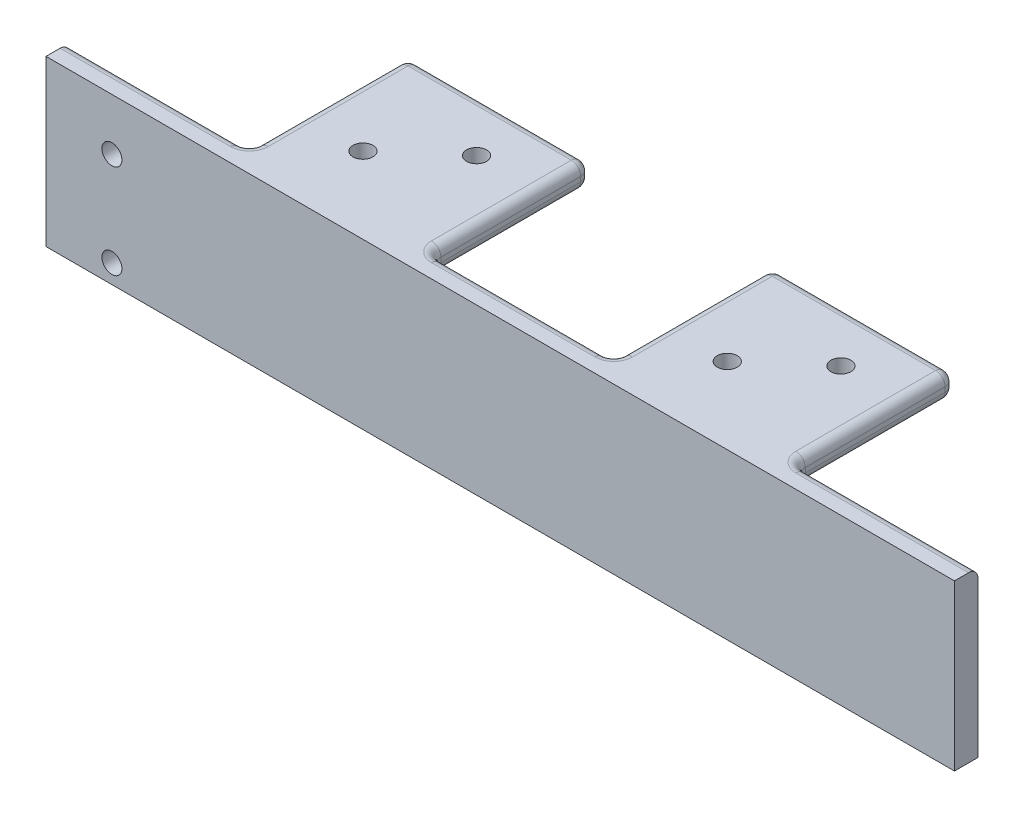
from build123d import *

# Parameters (mm, degrees)
SKETCH1_W           = 193
SKETCH1_H           = 5
BOSS_EXTRUDE1_DEPTH = 15
BOSS_EXTRUDE2_DEPTH = 5
CUT_EXTRUDE1_REACH  = 109.344
SKETCH3_R           = 2.125
FILLET3_R           = 2
FILLET4_R           = 2
SKETCH4_R           = 2.125
CUT_EXTRUDE2_DEPTH  = 106.877004204


with BuildPart() as part:
    # Sketch1 → Boss-Extrude1 (new, symmetric)
    with BuildSketch(Plane(origin=(0, 0, 0), x_dir=(1, 0, 0), z_dir=(0, 1, 0))):
        Rectangle(SKETCH1_W, SKETCH1_H)
    extrude(amount=BOSS_EXTRUDE1_DEPTH, both=True)

    # Sketch2 → Boss-Extrude2 (add)
    with BuildSketch(Plane(origin=(0, 15, 0), x_dir=(1, 0, 0), z_dir=(0, 1, 0))):
        Polygon((-58.3, 36.2), (-58.3, 2.5), (-96.5, 2.5), (-96.5, -2.5), (96.5, -2.5), (96.5, 2.5), (57.8, 2.5), (57.8, 36.2), (19.1, 36.2), (19.1, 2.5), (-19.6, 2.5), (-19.6, 36.2), align=None)
    extrude(amount=BOSS_EXTRUDE2_DEPTH)

    # Sketch3 → Cut-Extrude1 (cut, up to next)
    with BuildSketch(Plane.XZ.offset(-15), mode=Mode.PRIVATE) as cut_extrude1_sk1:
        with Locations(Location((-45.4, -13.73, 0), (0, 0, 270))):
            Circle(SKETCH3_R)
    cut_extrude1_tool1 = extrude(cut_extrude1_sk1.sketch, amount=-CUT_EXTRUDE1_REACH, mode=Mode.PRIVATE) & part.part
    # Sketch3 → Cut-Extrude1 (cut, up to next)
    with BuildSketch(Plane.XZ.offset(-15), mode=Mode.PRIVATE) as cut_extrude1_sk2:
        with Locations(Location((-32.5, -24.97, 0), (0, 0, 270))):
            Circle(SKETCH3_R)
    cut_extrude1_tool2 = extrude(cut_extrude1_sk2.sketch, amount=-CUT_EXTRUDE1_REACH, mode=Mode.PRIVATE) & part.part
    # Sketch3 → Cut-Extrude1 (cut, up to next)
    with BuildSketch(Plane.XZ.offset(-15), mode=Mode.PRIVATE) as cut_extrude1_sk3:
        with Locations(Location((32, -13.73, 0), (0, 0, 270))):
            Circle(SKETCH3_R)
    cut_extrude1_tool3 = extrude(cut_extrude1_sk3.sketch, amount=-CUT_EXTRUDE1_REACH, mode=Mode.PRIVATE) & part.part
    # Sketch3 → Cut-Extrude1 (cut, up to next)
    with BuildSketch(Plane.XZ.offset(-15), mode=Mode.PRIVATE) as cut_extrude1_sk4:
        with Locations(Location((44.9, -24.97, 0), (0, 0, 270))):
            Circle(SKETCH3_R)
    cut_extrude1_tool4 = extrude(cut_extrude1_sk4.sketch, amount=-CUT_EXTRUDE1_REACH, mode=Mode.PRIVATE) & part.part
    add(cut_extrude1_tool1.solids().sort_by_distance((-45.4, 15, -13.73))[0], mode=Mode.SUBTRACT)
    add(cut_extrude1_tool2.solids().sort_by_distance((-32.5, 15, -24.97))[0], mode=Mode.SUBTRACT)
    add(cut_extrude1_tool3.solids().sort_by_distance((32, 15, -13.73))[0], mode=Mode.SUBTRACT)
    add(cut_extrude1_tool4.solids().sort_by_distance((44.9, 15, -24.97))[0], mode=Mode.SUBTRACT)

    # Fillet3
    fillet3_edges = [part.edges().sort_by_distance(p)[0] for p in [
        (-58.3, 17.5, -36.2),
        (-58.3, 17.5, -2.5),
        (57.8, 17.5, -2.5),
        (57.8, 17.5, -36.2),
        (19.1, 17.5, -36.2),
        (19.1, 17.5, -2.5),
        (-19.6, 17.5, -2.5),
        (-19.6, 17.5, -36.2),
    ]]
    fillet(fillet3_edges, radius=FILLET3_R)

    # Fillet4
    # the kernel refuses this fillet: 2 mm, written as the material it takes off along each edge
    with BuildSketch(Plane(origin=(21.1, 20, -34.2), x_dir=(-1, 0, 0), z_dir=(0, 0, 1))) as fillet4_piece_1:
        with BuildLine():
            CenterArc((2 - FILLET4_R, FILLET4_R), FILLET4_R, 270, 90)
            Line((2 - FILLET4_R, 0), (2, 0))
            Line((2, 0), (2, FILLET4_R))
        make_face()
    revolve(axis=Axis((21.1, 20, -34.2), (0, -1, 0)), revolution_arc=90, mode=Mode.SUBTRACT)
    with BuildSketch(Plane(origin=(-21.6, 20, -34.2), x_dir=(1, 0, 0), z_dir=(0, 0, 1))) as fillet4_piece_2:
        with BuildLine():
            CenterArc((2 - FILLET4_R, -FILLET4_R), FILLET4_R, 0, 90)
            Line((2 - FILLET4_R, 0), (2, 0))
            Line((2, 0), (2, -FILLET4_R))
        make_face()
    revolve(axis=Axis((-21.6, 20, -34.2), (0, 1, 0)), revolution_arc=90, mode=Mode.SUBTRACT)
    with BuildSketch(Plane(origin=(-56.3, 20, -34.2), x_dir=(-1, 0, 0), z_dir=(0, 0, 1))) as fillet4_piece_3:
        with BuildLine():
            CenterArc((2 - FILLET4_R, FILLET4_R), FILLET4_R, 270, 90)
            Line((2 - FILLET4_R, 0), (2, 0))
            Line((2, 0), (2, FILLET4_R))
        make_face()
    revolve(axis=Axis((-56.3, 20, -34.2), (0, -1, 0)), revolution_arc=90, mode=Mode.SUBTRACT)
    with BuildSketch(Plane(origin=(19.1, 15, -34.2), x_dir=(0, 1, 0), z_dir=(0, 0, 1)), Plane(origin=(57.8, 15, -4.5), x_dir=(0, 1, 0), z_dir=(0, 0, -1)), Plane(origin=(-19.6, 15, -4.5), x_dir=(0, 1, 0), z_dir=(0, 0, -1)), Plane(origin=(-58.3, 15, -34.2), x_dir=(0, 1, 0), z_dir=(0, 0, 1))) as fillet4_piece_4:
        with BuildLine():
            CenterArc((FILLET4_R, -FILLET4_R), FILLET4_R, 90, 90)
            Line((0, -FILLET4_R), (0, 0))
            Line((0, 0), (FILLET4_R, 0))
        make_face()
    extrude(amount=29.7, mode=Mode.SUBTRACT)
    with BuildSketch(Plane(origin=(55.8, 15, -36.2), x_dir=(0, 1, 0), z_dir=(-1, 0, 0)), Plane(origin=(-21.6, 15, -36.2), x_dir=(0, 1, 0), z_dir=(-1, 0, 0))) as fillet4_piece_5:
        with BuildLine():
            CenterArc((FILLET4_R, -FILLET4_R), FILLET4_R, 90, 90)
            Line((0, -FILLET4_R), (0, 0))
            Line((0, 0), (FILLET4_R, 0))
        make_face()
    extrude(amount=34.7, mode=Mode.SUBTRACT)
    with BuildSketch(Plane(origin=(55.8, 15, -34.2), x_dir=(1, 0, 0), z_dir=(0, 0, 1))) as fillet4_piece_6:
        with BuildLine():
            CenterArc((2 - FILLET4_R, FILLET4_R), FILLET4_R, 270, 90)
            Line((2 - FILLET4_R, 0), (2, 0))
            Line((2, 0), (2, FILLET4_R))
        make_face()
    revolve(axis=Axis((55.8, 15, -34.2), (0, 1, 0)), revolution_arc=90, mode=Mode.SUBTRACT)
    with BuildSketch(Plane(origin=(21.1, 15, -34.2), x_dir=(-1, 0, 0), z_dir=(0, 0, 1))) as fillet4_piece_7:
        with BuildLine():
            CenterArc((2 - FILLET4_R, -FILLET4_R), FILLET4_R, 0, 90)
            Line((2 - FILLET4_R, 0), (2, 0))
            Line((2, 0), (2, -FILLET4_R))
        make_face()
    revolve(axis=Axis((21.1, 15, -34.2), (0, -1, 0)), revolution_arc=90, mode=Mode.SUBTRACT)
    with BuildSketch(Plane(origin=(-17.6, 15, -4.5), x_dir=(0.5976672776328267, 0, -0.8017442392976488), z_dir=(-0.8017442392976488, 0, -0.5976672776328267))) as fillet4_piece_8_section:
        with BuildLine():
            CenterArc((2 + FILLET4_R, -FILLET4_R), FILLET4_R, 90, 90)
            Line((2, -FILLET4_R), (2, 0))
            Line((2, 0), (2 + FILLET4_R, 0))
        make_face()
    fillet4_piece_8 = revolve(axis=Axis((-17.6, 15, -4.5), (0, -1, 0)), revolution_arc=233.296989237, mode=Mode.PRIVATE)
    fillet4_piece_8 = split(fillet4_piece_8, bisect_by=Plane(origin=(-19.099877837, 15.623256941, -2.5), z_dir=(0, 0, -1)), keep=Keep.TOP, mode=Mode.PRIVATE)
    add(fillet4_piece_8, mode=Mode.SUBTRACT)
    with BuildSketch(Plane(origin=(-17.6, 20, -4.5), x_dir=(0, 0, 1), z_dir=(1, 0, 0))) as fillet4_piece_9:
        with BuildLine():
            CenterArc((2 + FILLET4_R, FILLET4_R), FILLET4_R, 180, 90)
            Line((2 + FILLET4_R, 0), (2, 0))
            Line((2, 0), (2, FILLET4_R))
        make_face()
    revolve(axis=Axis((-17.6, 20, -4.5), (0, -1, 0)), revolution_arc=90, mode=Mode.SUBTRACT)
    with BuildSketch(Plane(origin=(-60.3, 15, -4.5), x_dir=(-0.5976672776328267, 0, -0.8017442392976488), z_dir=(0.8017442392976488, 0, -0.5976672776328267))) as fillet4_piece_10_section:
        with BuildLine():
            CenterArc((2 + FILLET4_R, FILLET4_R), FILLET4_R, 180, 90)
            Line((2 + FILLET4_R, 0), (2, 0))
            Line((2, 0), (2, FILLET4_R))
        make_face()
    fillet4_piece_10 = revolve(axis=Axis((-60.3, 15, -4.5), (0, 1, 0)), revolution_arc=233.296989237, mode=Mode.PRIVATE)
    fillet4_piece_10 = split(fillet4_piece_10, bisect_by=Plane(origin=(-58.800122111, 15.623256622, -2.5), z_dir=(0, 0, -1)), keep=Keep.TOP, mode=Mode.PRIVATE)
    add(fillet4_piece_10, mode=Mode.SUBTRACT)
    with BuildSketch(Plane(origin=(-60.3, 20, -4.5), x_dir=(0, 0, 1), z_dir=(-1, 0, 0))) as fillet4_piece_11:
        with BuildLine():
            CenterArc((2 + FILLET4_R, -FILLET4_R), FILLET4_R, 90, 90)
            Line((2 + FILLET4_R, 0), (2, 0))
            Line((2, 0), (2, -FILLET4_R))
        make_face()
    revolve(axis=Axis((-60.3, 20, -4.5), (0, 1, 0)), revolution_arc=90, mode=Mode.SUBTRACT)
    with BuildSketch(Plane(origin=(17.1, 15, -4.5), x_dir=(-0.5976672776328281, 0, -0.8017442392976479), z_dir=(0.8017442392976479, 0, -0.5976672776328281))) as fillet4_piece_12_section:
        with BuildLine():
            CenterArc((2 + FILLET4_R, FILLET4_R), FILLET4_R, 180, 90)
            Line((2 + FILLET4_R, 0), (2, 0))
            Line((2, 0), (2, FILLET4_R))
        make_face()
    fillet4_piece_12 = revolve(axis=Axis((17.1, 15, -4.5), (0, 1, 0)), revolution_arc=233.296989237, mode=Mode.PRIVATE)
    fillet4_piece_12 = split(fillet4_piece_12, bisect_by=Plane(origin=(18.599877909, 15.623256541, -2.5), z_dir=(0, 0, -1)), keep=Keep.TOP, mode=Mode.PRIVATE)
    add(fillet4_piece_12, mode=Mode.SUBTRACT)
    with BuildSketch(Plane(origin=(17.1, 20, -4.5), x_dir=(0, 0, 1), z_dir=(-1, 0, 0))) as fillet4_piece_13:
        with BuildLine():
            CenterArc((2 + FILLET4_R, -FILLET4_R), FILLET4_R, 90, 90)
            Line((2 + FILLET4_R, 0), (2, 0))
            Line((2, 0), (2, -FILLET4_R))
        make_face()
    revolve(axis=Axis((17.1, 20, -4.5), (0, 1, 0)), revolution_arc=90, mode=Mode.SUBTRACT)
    with BuildSketch(Plane(origin=(59.8, 15, -4.5), x_dir=(0.5976672776328267, 0, -0.8017442392976488), z_dir=(-0.8017442392976488, 0, -0.5976672776328267))) as fillet4_piece_14_section:
        with BuildLine():
            CenterArc((2 + FILLET4_R, -FILLET4_R), FILLET4_R, 90, 90)
            Line((2, -FILLET4_R), (2, 0))
            Line((2, 0), (2 + FILLET4_R, 0))
        make_face()
    fillet4_piece_14 = revolve(axis=Axis((59.8, 15, -4.5), (0, -1, 0)), revolution_arc=233.296989237, mode=Mode.PRIVATE)
    fillet4_piece_14 = split(fillet4_piece_14, bisect_by=Plane(origin=(58.300122152, 15.623256947, -2.5), z_dir=(0, 0, -1)), keep=Keep.TOP, mode=Mode.PRIVATE)
    add(fillet4_piece_14, mode=Mode.SUBTRACT)
    with BuildSketch(Plane(origin=(59.8, 20, -4.5), x_dir=(0, 0, 1), z_dir=(1, 0, 0))) as fillet4_piece_15:
        with BuildLine():
            CenterArc((2 + FILLET4_R, FILLET4_R), FILLET4_R, 180, 90)
            Line((2 + FILLET4_R, 0), (2, 0))
            Line((2, 0), (2, FILLET4_R))
        make_face()
    revolve(axis=Axis((59.8, 20, -4.5), (0, -1, 0)), revolution_arc=90, mode=Mode.SUBTRACT)
    with BuildSketch(Plane(origin=(101.5, 20, -2.5), x_dir=(0, -1, 0), z_dir=(-1, 0, 0))) as fillet4_piece_16:
        with BuildLine():
            CenterArc((FILLET4_R, FILLET4_R), FILLET4_R, 180, 90)
            Line((0, FILLET4_R), (0, 0))
            Line((0, 0), (FILLET4_R, 0))
        make_face()
    extrude(amount=41.7, mode=Mode.SUBTRACT)
    with BuildSketch(Plane(origin=(-19.6, 20, -4.5), x_dir=(0, -1, 0), z_dir=(0, 0, -1)), Plane(origin=(-58.3, 20, -34.2), x_dir=(0, -1, 0), z_dir=(0, 0, 1)), Plane(origin=(57.8, 20, -4.5), x_dir=(0, -1, 0), z_dir=(0, 0, -1)), Plane(origin=(19.1, 20, -34.2), x_dir=(0, -1, 0), z_dir=(0, 0, 1))) as fillet4_piece_17:
        with BuildLine():
            CenterArc((FILLET4_R, FILLET4_R), FILLET4_R, 180, 90)
            Line((0, FILLET4_R), (0, 0))
            Line((0, 0), (FILLET4_R, 0))
        make_face()
    extrude(amount=29.7, mode=Mode.SUBTRACT)
    with BuildSketch(Plane(origin=(-60.3, 20, -2.5), x_dir=(0, -1, 0), z_dir=(-1, 0, 0))) as fillet4_piece_18:
        with BuildLine():
            CenterArc((FILLET4_R, FILLET4_R), FILLET4_R, 180, 90)
            Line((0, FILLET4_R), (0, 0))
            Line((0, 0), (FILLET4_R, 0))
        make_face()
    extrude(amount=41.2, mode=Mode.SUBTRACT)
    with BuildSketch(Plane(origin=(17.1, 20, -2.5), x_dir=(0, -1, 0), z_dir=(-1, 0, 0)), Plane(origin=(-21.6, 20, -36.2), x_dir=(0, -1, 0), z_dir=(-1, 0, 0)), Plane(origin=(55.8, 20, -36.2), x_dir=(0, -1, 0), z_dir=(-1, 0, 0))) as fillet4_piece_19:
        with BuildLine():
            CenterArc((FILLET4_R, FILLET4_R), FILLET4_R, 180, 90)
            Line((0, FILLET4_R), (0, 0))
            Line((0, 0), (FILLET4_R, 0))
        make_face()
    extrude(amount=34.7, mode=Mode.SUBTRACT)
    with BuildSketch(Plane(origin=(-21.6, 15, -34.2), x_dir=(1, 0, 0), z_dir=(0, 0, 1))) as fillet4_piece_20:
        with BuildLine():
            CenterArc((2 - FILLET4_R, FILLET4_R), FILLET4_R, 270, 90)
            Line((2 - FILLET4_R, 0), (2, 0))
            Line((2, 0), (2, FILLET4_R))
        make_face()
    revolve(axis=Axis((-21.6, 15, -34.2), (0, 1, 0)), revolution_arc=90, mode=Mode.SUBTRACT)
    with BuildSketch(Plane(origin=(-56.3, 15, -34.2), x_dir=(-1, 0, 0), z_dir=(0, 0, 1))) as fillet4_piece_21:
        with BuildLine():
            CenterArc((2 - FILLET4_R, -FILLET4_R), FILLET4_R, 0, 90)
            Line((2 - FILLET4_R, 0), (2, 0))
            Line((2, 0), (2, -FILLET4_R))
        make_face()
    revolve(axis=Axis((-56.3, 15, -34.2), (0, -1, 0)), revolution_arc=90, mode=Mode.SUBTRACT)
    with BuildSketch(Plane(origin=(55.8, 20, -34.2), x_dir=(1, 0, 0), z_dir=(0, 0, 1))) as fillet4_piece_22:
        with BuildLine():
            CenterArc((2 - FILLET4_R, -FILLET4_R), FILLET4_R, 0, 90)
            Line((2 - FILLET4_R, 0), (2, 0))
            Line((2, 0), (2, -FILLET4_R))
        make_face()
    revolve(axis=Axis((55.8, 20, -34.2), (0, 1, 0)), revolution_arc=90, mode=Mode.SUBTRACT)

    # Sketch4 → Cut-Extrude2 (cut, through all)
    with BuildSketch(Plane.XY.offset(2.5)):
        with Locations((-82.5, 9)):
            Circle(SKETCH4_R)
        with Locations((-82.5, -11)):
            Circle(SKETCH4_R)
    extrude(amount=-CUT_EXTRUDE2_DEPTH, mode=Mode.SUBTRACT)


solid = part.part
